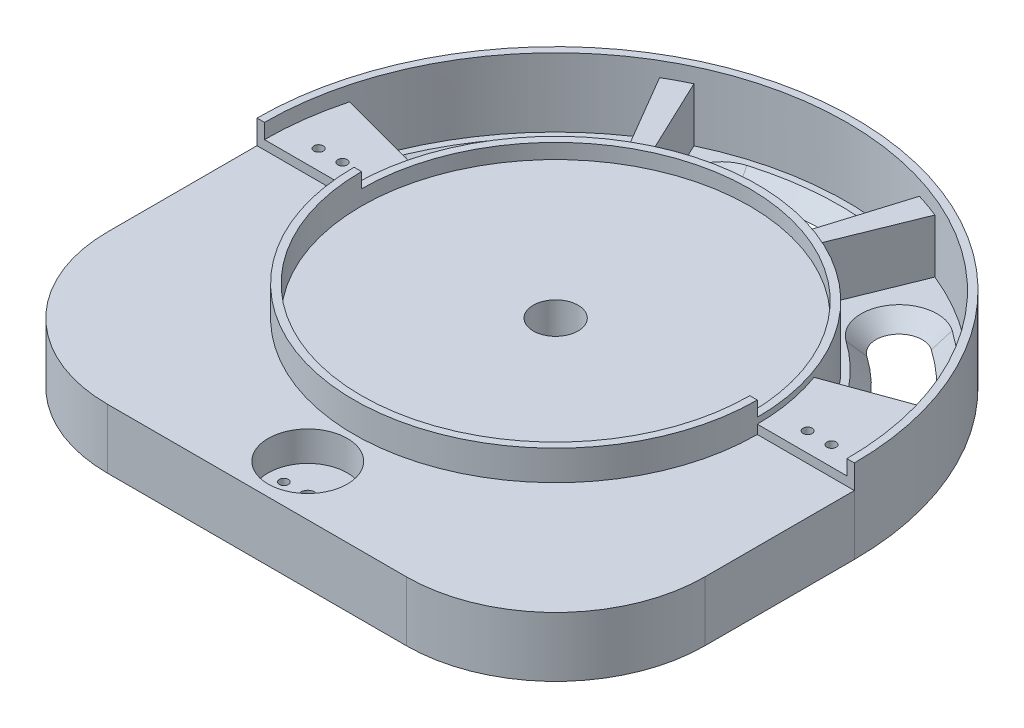
from build123d import *

# Parameters (mm, degrees)
BOSS_EXTRUDE1_DEPTH        = 33
CUT_EXTRUDE1_DEPTH         = 40
CUT_EXTRUDE2_DEPTH         = 40
CUT_EXTRUDE3_DEPTH         = 40
BOSS_EXTRUDE3_START        = 30
BOSS_EXTRUDE3_DEPTH        = 30
SKETCH26_W                 = 200
SKETCH26_H                 = 30
BOSS_EXTRUDE6_DEPTH        = 120
SKETCH28_R                 = 156.204993518
CUT_EXTRUDE4_DEPTH         = 40
CUT_EXTRUDE5_START         = -25
SKETCH29_R                 = 100
CUT_EXTRUDE5_DEPTH         = 25
CUT_EXTRUDE8_DEPTH         = 20
SKETCH31_R                 = 156.204993518
SKETCH31_R_2               = 100
CUT_EXTRUDE9_DEPTH         = 20
CUT_EXTRUDE10_DEPTH        = 20
BOSS_EXTRUDE8_START        = -10
SKETCH33_R                 = 65
BOSS_EXTRUDE8_DEPTH        = 10
CUT_EXTRUDE11_DEPTH        = 15
CHAMFER2_SIZE              = 7
SKETCH35_R                 = 7.5
CUT_EXTRUDE12_DEPTH        = 143.828568571
SKETCH36_R                 = 12.5
SKETCH36_R_2               = 7.5
BOSS_EXTRUDE9_DEPTH        = 5
SKETCH37_W                 = 200
SKETCH37_H                 = 100
BOSS_EXTRUDE10_DEPTH       = 20
SKETCH38_R                 = 7.5
CUT_EXTRUDE13_DEPTH        = 15
FILLET1_R                  = 50
SKETCH40_R                 = 97.5
CUT_EXTRUDE14_DEPTH        = 5
BOSS_EXTRUDE11_OUTLINE_R   = 67.5
BOSS_EXTRUDE11_OUTLINE_R_2 = 65
BOSS_EXTRUDE11_DEPTH       = 5
BOSS_EXTRUDE12_DEPTH       = 10
CUT_EXTRUDE15_DEPTH        = 143.828568571
CUT_EXTRUDE15_DEPTH_BACK   = 143.828568571
SKETCH48_R                 = 1.55
SKETCH50_R                 = 13.25
CUT_EXTRUDE16_DEPTH        = 10
CUT_EXTRUDE17_DEPTH        = 143.828568571
CUT_EXTRUDE17_DEPTH_BACK   = 143.828568571
SKETCH51_R                 = 2.25
SKETCH51_R_2               = 1.5
SKETCH52_R                 = 12.8
CUT_EXTRUDE18_DEPTH        = 5
CUT_EXTRUDE19_DEPTH        = 5
CUT_EXTRUDE20_DEPTH        = 5


# Read off the part's stored shape, not the designer's step: Boss-Extrude11
with BuildPart() as part:
    # Sketch1 → Boss-Extrude1 (new body)
    with BuildSketch(Plane(origin=(0, 0, 0), x_dir=(1, 0, 0), z_dir=(0, 1, 0))):
        with BuildLine():
            ThreePointArc((100, 0), (0, 100), (-100, 0))
            Line((-100, 0), (-65, 0))
            ThreePointArc((-65, 0), (0, 65), (65, 0))
            Line((65, 0), (100, 0))
        make_face()
    extrude(amount=BOSS_EXTRUDE1_DEPTH)

    # Sketch3 → Cut-Extrude1 (cut)
    with BuildSketch(Plane(origin=(0, 33, 0), x_dir=(1, 0, 0), z_dir=(0, 1, 0))):
        with BuildLine():
            ThreePointArc((91.620030527, 33.346963974), (70.158955681, 67.705028895), (36.586411012, 90.3752429))
            Line((36.586411012, 90.3752429), (25.329053777, 62.567475854))
            ThreePointArc((25.329053777, 62.567475854), (48.571584702, 46.872712312), (63.429251903, 23.086359674))
            Line((63.429251903, 23.086359674), (91.620030527, 33.346963974))
        make_face()
    extrude(amount=-CUT_EXTRUDE1_DEPTH, mode=Mode.SUBTRACT)

    # Sketch4 → Cut-Extrude2 (cut)
    with BuildSketch(Plane(origin=(0, 33, 0), x_dir=(1, 0, 0), z_dir=(0, 1, 0))):
        with BuildLine():
            Line((-41.791558708, 88.089248043), (-28.932617567, 60.98486403))
            ThreePointArc((-28.932617567, 60.98486403), (-4.909072096, 67.321252299), (19.779554251, 64.536960214))
            Line((19.779554251, 64.536960214), (28.570467251, 93.220053642))
            ThreePointArc((28.570467251, 93.220053642), (-7.090881917, 97.241808877), (-41.791558708, 88.089248043))
        make_face()
    extrude(amount=-CUT_EXTRUDE2_DEPTH, mode=Mode.SUBTRACT)

    # Sketch5 → Cut-Extrude3 (cut)
    with BuildSketch(Plane(origin=(0, 33, 0), x_dir=(1, 0, 0), z_dir=(0, 1, 0))):
        with BuildLine():
            ThreePointArc((-65.199993275, 17.470285544), (-53.687582374, 40.913243562), (-34.137701343, 58.231154436))
            Line((-34.137701343, 58.231154436), (-49.310013051, 84.111667519))
            ThreePointArc((-49.310013051, 84.111667519), (-77.548730096, 59.096907368), (-94.177768063, 25.234856897))
            Line((-94.177768063, 25.234856897), (-65.199993275, 17.470285544))
        make_face()
    extrude(amount=-CUT_EXTRUDE3_DEPTH, mode=Mode.SUBTRACT)

    # Sketch8 → Boss-Extrude3 (add)
    with BuildSketch(Plane.XZ.offset(BOSS_EXTRUDE3_START)):
        with BuildLine():
            Line((-65, 0), (-100, 0))
            ThreePointArc((-100, 0), (0, -100), (100, 0))
            Line((100, 0), (65, 0))
            ThreePointArc((65, 0), (0, -65), (-65, 0))
        make_face()
    extrude(amount=-BOSS_EXTRUDE3_DEPTH)

    # Sketch26 → Boss-Extrude6 (add)
    with BuildSketch(Plane.XY):
        with Locations((0, -15)):
            Rectangle(SKETCH26_W, SKETCH26_H)
    extrude(amount=BOSS_EXTRUDE6_DEPTH)

    # Sketch28 → Cut-Extrude4 (cut)
    with BuildSketch(Plane.XZ.offset(60)):
        Circle(SKETCH28_R)
    extrude(amount=-CUT_EXTRUDE4_DEPTH, mode=Mode.SUBTRACT)

    # Sketch29 → Cut-Extrude5 (cut)
    with BuildSketch(Plane(origin=(0, 33, 0), x_dir=(1, 0, 0), z_dir=(0, 1, 0)).offset(CUT_EXTRUDE5_START)):
        Circle(SKETCH29_R)
    extrude(amount=CUT_EXTRUDE5_DEPTH, mode=Mode.SUBTRACT)

    # Sketch30 → Cut-Extrude8 (cut)
    with BuildSketch(Plane.XZ.offset(20)):
        with BuildLine():
            ThreePointArc((-99.143723606, 13.058409912), (6.543227008, 99.785701282), (100, 0))
            Line((100, 0), (100, 120))
            Line((100, 120), (-100, 120))
            Line((-100, 120), (-99.143723606, 13.058409912))
        make_face()
    extrude(amount=-CUT_EXTRUDE8_DEPTH, mode=Mode.SUBTRACT)

    # Sketch31 → Cut-Extrude9 (cut)
    with BuildSketch(Plane(origin=(0, -20, 0), x_dir=(-1, 0, 0), z_dir=(0, -1, 0))):
        Circle(SKETCH31_R)
        with Locations(Location((0, 0, 0), (0, 0, 90))):
            Circle(SKETCH31_R_2, mode=Mode.SUBTRACT)
    extrude(amount=-CUT_EXTRUDE9_DEPTH, mode=Mode.SUBTRACT)

    # Sketch32 → Cut-Extrude10 (cut)
    with BuildSketch(Plane(origin=(0, 0, 0), x_dir=(1, 0, 0), z_dir=(0, 1, 0))):
        with BuildLine():
            ThreePointArc((66.28370188, 38.682846188), (74.154069941, 36.613340263), (76.223575866, 44.483708324))
            ThreePointArc((76.223575866, 44.483708324), (65.061093766, 59.631266145), (50.941192214, 72.068222955))
            ThreePointArc((50.941192214, 72.068222955), (42.920720385, 70.690696246), (44.298247095, 62.670224417))
            ThreePointArc((44.298247095, 62.670224417), (56.576854263, 51.855098937), (66.28370188, 38.682846188))
        make_face()
        with BuildLine():
            ThreePointArc((10.489916637, 76.025346912), (16.976811553, 80.939178669), (12.062979796, 87.426073585))
            ThreePointArc((12.062979796, 87.426073585), (-6.744582107, 87.996275127), (-25.24556204, 84.566514776))
            ThreePointArc((-25.24556204, 84.566514776), (-29.113412559, 77.406537084), (-21.953434866, 73.538686565))
            ThreePointArc((-21.953434866, 73.538686565), (-5.865060312, 76.521191781), (10.489916637, 76.025346912))
        make_face()
        with BuildLine():
            ThreePointArc((-51.296662451, 57.083659181), (-50.862754743, 65.209991213), (-58.989086775, 65.643898921))
            ThreePointArc((-58.989086775, 65.643898921), (-71.788973817, 51.333975711), (-81.19140666, 34.594642774))
            ThreePointArc((-81.19140666, 34.594642774), (-78.153199938, 27.045149539), (-70.603706703, 30.083356261))
            ThreePointArc((-70.603706703, 30.083356261), (-62.427390538, 44.639809976), (-51.296662451, 57.083659181))
        make_face()
    extrude(amount=-CUT_EXTRUDE10_DEPTH, mode=Mode.SUBTRACT)

    # Sketch33 → Boss-Extrude8 (add)
    with BuildSketch(Plane(origin=(0, 0, 0), x_dir=(1, 0, 0), z_dir=(0, 1, 0)).offset(BOSS_EXTRUDE8_START)):
        Circle(SKETCH33_R)
    extrude(amount=BOSS_EXTRUDE8_DEPTH)

    # Sketch34 → Cut-Extrude11 (cut)
    with BuildSketch(Plane(origin=(0, 0, 0), x_dir=(1, 0, 0), z_dir=(0, 1, 0))):
        with BuildLine():
            Line((63.429251903, 23.086359674), (91.620030527, 33.346963974))
            ThreePointArc((91.620030527, 33.346963974), (70.158955681, 67.705028895), (36.586411012, 90.3752429))
            Line((36.586411012, 90.3752429), (25.329053777, 62.567475854))
            ThreePointArc((25.329053777, 62.567475854), (48.571584702, 46.872712312), (63.429251903, 23.086359674))
        make_face()
        with BuildLine():
            Line((19.779554251, 64.536960214), (28.570467251, 93.220053642))
            ThreePointArc((28.570467251, 93.220053642), (-7.090881917, 97.241808877), (-41.791558708, 88.089248043))
            Line((-41.791558708, 88.089248043), (-28.932617567, 60.98486403))
            ThreePointArc((-28.932617567, 60.98486403), (-4.909072096, 67.321252299), (19.779554251, 64.536960214))
        make_face()
        with BuildLine():
            Line((-34.137701343, 58.231154436), (-49.310013051, 84.111667519))
            ThreePointArc((-49.310013051, 84.111667519), (-77.548730096, 59.096907368), (-94.177768063, 25.234856897))
            Line((-94.177768063, 25.234856897), (-65.199993275, 17.470285544))
            ThreePointArc((-65.199993275, 17.470285544), (-53.687582374, 40.913243562), (-34.137701343, 58.231154436))
        make_face()
    extrude(amount=-CUT_EXTRUDE11_DEPTH, mode=Mode.SUBTRACT)

    # Chamfer2
    # the kernel refuses this chamfer: 7 mm, written as the material it takes off along each edge
    with BuildSketch(Plane(origin=(0, -15, 0), x_dir=(-0.6683984801552533, 0, -0.7438033824379582), z_dir=(0.7438033824379582, 0, -0.6683984801552533))) as chamfer2_piece_1:
        Polygon((88.25437, -CHAMFER2_SIZE), (88.25437 + CHAMFER2_SIZE, 0), (88.25437, 0), align=None)
    revolve(axis=Axis((0, -15, 0), (0, 1, 0)), revolution_arc=24.978173914, mode=Mode.SUBTRACT)
    with BuildSketch(Plane(origin=(-55.142874613, -15, -61.363779051), x_dir=(0.668398480155252, 0, 0.7438033824379592), z_dir=(-0.7438033824379592, 0, 0.668398480155252))) as chamfer2_piece_2:
        Polygon((5.75437, -CHAMFER2_SIZE), (5.75437 + CHAMFER2_SIZE, 0), (5.75437, 0), align=None)
    revolve(axis=Axis((-55.142874613, -15, -61.363779051), (0, 1, 0)), revolution_arc=180, mode=Mode.SUBTRACT)
    with BuildSketch(Plane(origin=(-75.897556681, -15, -32.338999517), x_dir=(-0.919970384017718, 0, -0.3919878729377892), z_dir=(0.3919878729377892, 0, -0.919970384017718))) as chamfer2_piece_3_section:
        Polygon((5.75437, -CHAMFER2_SIZE), (5.75437 + CHAMFER2_SIZE, 0), (5.75437, 0), align=None)
    chamfer2_piece_3 = revolve(axis=Axis((-75.897556681, -15, -32.338999517), (0, 1, 0)), revolution_arc=180, mode=Mode.PRIVATE)
    chamfer2_piece_3 = split(chamfer2_piece_3, bisect_by=Plane(origin=(-80.145870911, -18.437935535, -21.475021387), z_dir=(0.2588190451025148, 0, -0.9659258262890699)), keep=Keep.TOP, mode=Mode.PRIVATE)
    add(chamfer2_piece_3, mode=Mode.SUBTRACT)
    with BuildSketch(Plane(origin=(0, -15, 0), x_dir=(-0.6683984801552512, 0, -0.7438033824379602), z_dir=(0.7438033824379602, 0, -0.6683984801552512))) as chamfer2_piece_4:
        Polygon((76.74563, -CHAMFER2_SIZE), (76.74563 - CHAMFER2_SIZE, 0), (76.74563, 0), align=None)
    revolve(axis=Axis((0, -15, 0), (0, 1, 0)), revolution_arc=24.978173914, mode=Mode.SUBTRACT)
    with BuildSketch(Plane(origin=(0, -15, 0), x_dir=(0.1366842208067535, 0, -0.9906146696786046), z_dir=(0.9906146696786046, 0, 0.1366842208067535))) as chamfer2_piece_5:
        Polygon((88.25437, -CHAMFER2_SIZE), (88.25437 + CHAMFER2_SIZE, 0), (88.25437, 0), align=None)
    revolve(axis=Axis((0, -15, 0), (0, 1, 0)), revolution_arc=24.477914532, mode=Mode.SUBTRACT)
    with BuildSketch(Plane(origin=(11.276448217, -15, -81.725710248), x_dir=(-0.13668422080675505, 0, 0.9906146696786042), z_dir=(-0.9906146696786042, 0, -0.13668422080675505))) as chamfer2_piece_6:
        Polygon((5.75437, -CHAMFER2_SIZE), (5.75437 + CHAMFER2_SIZE, 0), (5.75437, 0), align=None)
    revolve(axis=Axis((11.276448217, -15, -81.725710248), (0, 1, 0)), revolution_arc=180, mode=Mode.SUBTRACT)
    with BuildSketch(Plane(origin=(-23.599498453, -15, -79.052600671), x_dir=(-0.2860545267014413, 0, -0.9582133414608746), z_dir=(0.9582133414608746, 0, -0.2860545267014413))) as chamfer2_piece_7_section:
        Polygon((5.75437, -CHAMFER2_SIZE), (5.75437 + CHAMFER2_SIZE, 0), (5.75437, 0), align=None)
    chamfer2_piece_7 = revolve(axis=Axis((-23.599498453, -15, -79.052600671), (0, 1, 0)), revolution_arc=180, mode=Mode.PRIVATE)
    chamfer2_piece_7 = split(chamfer2_piece_7, bisect_by=Plane(origin=(-35.54966771, -18.437744319, -74.93244075), z_dir=(0.9034794671049792, 0, -0.428631371366706)), keep=Keep.TOP, mode=Mode.PRIVATE)
    add(chamfer2_piece_7, mode=Mode.SUBTRACT)
    with BuildSketch(Plane(origin=(0, -15, 0), x_dir=(0.13668422080675355, 0, -0.9906146696786046), z_dir=(0.9906146696786046, 0, 0.13668422080675355))) as chamfer2_piece_8:
        Polygon((76.74563, -CHAMFER2_SIZE), (76.74563 - CHAMFER2_SIZE, 0), (76.74563, 0), align=None)
    revolve(axis=Axis((0, -15, 0), (0, 1, 0)), revolution_arc=24.477914532, mode=Mode.SUBTRACT)
    with BuildSketch(Plane(origin=(0, -15, 0), x_dir=(0.8636804711885281, 0, -0.5040397243150209), z_dir=(0.5040397243150209, 0, 0.8636804711885281))) as chamfer2_piece_9:
        Polygon((88.25437, -CHAMFER2_SIZE), (88.25437 + CHAMFER2_SIZE, 0), (88.25437, 0), align=None)
    revolve(axis=Axis((0, -15, 0), (0, 1, 0)), revolution_arc=24.477914532, mode=Mode.SUBTRACT)
    with BuildSketch(Plane(origin=(71.253638873, -15, -41.583277256), x_dir=(-0.8636804711885285, 0, 0.5040397243150201), z_dir=(-0.5040397243150201, 0, -0.8636804711885285))) as chamfer2_piece_10:
        Polygon((5.75437, -CHAMFER2_SIZE), (5.75437 + CHAMFER2_SIZE, 0), (5.75437, 0), align=None)
    revolve(axis=Axis((71.253638873, -15, -41.583277256), (0, 1, 0)), revolution_arc=180, mode=Mode.SUBTRACT)
    with BuildSketch(Plane(origin=(47.619719655, -15, -67.369223686), x_dir=(0.577208723085647, 0, -0.8165966507363577), z_dir=(0.8165966507363577, 0, 0.577208723085647))) as chamfer2_piece_11:
        Polygon((5.75437, -CHAMFER2_SIZE), (5.75437 + CHAMFER2_SIZE, 0), (5.75437, 0), align=None)
    revolve(axis=Axis((47.619719655, -15, -67.369223686), (0, 1, 0)), revolution_arc=180, mode=Mode.SUBTRACT)
    with BuildSketch(Plane(origin=(0, -15, 0), x_dir=(0.8636804711885259, 0, -0.5040397243150245), z_dir=(0.5040397243150245, 0, 0.8636804711885259))) as chamfer2_piece_12:
        Polygon((76.74563, -CHAMFER2_SIZE), (76.74563 - CHAMFER2_SIZE, 0), (76.74563, 0), align=None)
    revolve(axis=Axis((0, -15, 0), (0, 1, 0)), revolution_arc=24.477914532, mode=Mode.SUBTRACT)

    # Sketch35 → Cut-Extrude12 (cut, through all)
    with BuildSketch(Plane(origin=(0, 0, 0), x_dir=(1, 0, 0), z_dir=(0, 1, 0))):
        with Locations(Location((0, 0, 0), (0, 0, 270))):
            Circle(SKETCH35_R)
    extrude(amount=-CUT_EXTRUDE12_DEPTH, mode=Mode.SUBTRACT)

    # Sketch36 → Boss-Extrude9 (add)
    with BuildSketch(Plane(origin=(0, -10, 0), x_dir=(-1, 0, 0), z_dir=(0, -1, 0))):
        Circle(SKETCH36_R)
        with Locations(Location((0, 0, 0), (0, 0, 270))):
            Circle(SKETCH36_R_2, mode=Mode.SUBTRACT)
    extrude(amount=BOSS_EXTRUDE9_DEPTH)

    # Sketch37 → Boss-Extrude10 (add)
    with BuildSketch(Plane(origin=(0, 0, 0), x_dir=(1, 0, 0), z_dir=(0, 1, 0))):
        with Locations((0, -50)):
            Rectangle(SKETCH37_W, SKETCH37_H)
    extrude(amount=-BOSS_EXTRUDE10_DEPTH)

    # Sketch38 → Cut-Extrude13 (cut)
    with BuildSketch(Plane(origin=(0, 0, 0), x_dir=(1, 0, 0), z_dir=(0, 1, 0))):
        with Locations(Location((0, 0, 0), (0, 0, 270))):
            Circle(SKETCH38_R)
    extrude(amount=-CUT_EXTRUDE13_DEPTH, mode=Mode.SUBTRACT)

    # Fillet1
    fillet1_edges = [part.edges().sort_by_distance(p)[0] for p in [
        (-100, -10, 100),
        (100, -10, 100),
    ]]
    fillet(fillet1_edges, radius=FILLET1_R)

    # Sketch40 → Cut-Extrude14 (cut)
    with BuildSketch(Plane(origin=(0, 8, 0), x_dir=(1, 0, 0), z_dir=(0, 1, 0))):
        Circle(SKETCH40_R)
    extrude(amount=-CUT_EXTRUDE14_DEPTH, mode=Mode.SUBTRACT)

    # Boss-Extrude11 outline → Boss-Extrude11 (add)
    with BuildSketch(Plane(origin=(0, 0, 0), x_dir=(1, 0, 0), z_dir=(0, 1, 0))):
        Circle(BOSS_EXTRUDE11_OUTLINE_R)
        Circle(BOSS_EXTRUDE11_OUTLINE_R_2, mode=Mode.SUBTRACT)
    extrude(amount=BOSS_EXTRUDE11_DEPTH)

    # Sketch44 → Boss-Extrude12 (add)
    with BuildSketch(Plane(origin=(0, 0, 0), x_dir=(1, 0, 0), z_dir=(0, 1, 0))):
        with BuildLine():
            Line((-67.5, 0), (-65, 0))
            ThreePointArc((-65, 0), (0, -65), (65, 0))
            Line((65, 0), (67.5, 0))
            ThreePointArc((67.5, 0), (0, -67.5), (-67.5, 0))
        make_face()
    extrude(amount=BOSS_EXTRUDE12_DEPTH)

    # Sketch48 → Cut-Extrude15 (cut, two sides: drawn at the far end of the back side and taken through both)
    with BuildSketch(Plane(origin=(0, 0, 0), x_dir=(1, 0, 0), z_dir=(0, 1, 0)).offset(-CUT_EXTRUDE15_DEPTH_BACK)):
        with Locations(Location((-85.865, 6.5, 0), (0, 0, 270))):
            Circle(SKETCH48_R)
        with Locations(Location((-77.865, 6.5, 0), (0, 0, 270))):
            Circle(SKETCH48_R)
        with Locations(Location((77.865, 6.5, 0), (0, 0, 270))):
            Circle(SKETCH48_R)
        with Locations(Location((85.865, 6.5, 0), (0, 0, 270))):
            Circle(SKETCH48_R)
    extrude(amount=CUT_EXTRUDE15_DEPTH + CUT_EXTRUDE15_DEPTH_BACK, mode=Mode.SUBTRACT)

    # Sketch50 → Cut-Extrude16 (cut)
    with BuildSketch(Plane(origin=(0, 0, 0), x_dir=(1, 0, 0), z_dir=(0, 1, 0))):
        with Locations(Location((0, -83, 0), (0, 0, 270))):
            Circle(SKETCH50_R)
    extrude(amount=-CUT_EXTRUDE16_DEPTH, mode=Mode.SUBTRACT)

    # Sketch51 → Cut-Extrude17 (cut, two sides: drawn at the far end of the back side and taken through both)
    with BuildSketch(Plane(origin=(0, -10, 0), x_dir=(1, 0, 0), z_dir=(0, 1, 0)).offset(-CUT_EXTRUDE17_DEPTH_BACK)):
        with Locations(Location((0, -83, 0), (0, 0, 270))):
            Circle(SKETCH51_R)
        with Locations(Location((-8, -83, 0), (0, 0, 270))):
            Circle(SKETCH51_R_2)
        with Locations(Location((8, -83, 0), (0, 0, 270))):
            Circle(SKETCH51_R_2)
    extrude(amount=CUT_EXTRUDE17_DEPTH + CUT_EXTRUDE17_DEPTH_BACK, mode=Mode.SUBTRACT)

    # Sketch52 → Cut-Extrude18 (cut)
    with BuildSketch(Plane.XZ.offset(20)):
        with Locations(Location((0, 83, 0), (0, 0, 270))):
            Circle(SKETCH52_R)
    extrude(amount=-CUT_EXTRUDE18_DEPTH, mode=Mode.SUBTRACT)

    # Sketch53 → Cut-Extrude19 (cut)
    with BuildSketch(Plane.XZ.offset(20)):
        with BuildLine():
            ThreePointArc((12.8, 83), (0, 70.2), (-12.8, 83))
            Line((-12.8, 83), (-36.25, 0))
            Line((-36.25, 0), (0, 0))
            Line((0, 0), (36.25, 0))
            Line((36.25, 0), (12.8, 83))
        make_face()
    extrude(amount=-CUT_EXTRUDE19_DEPTH, mode=Mode.SUBTRACT)

    # Sketch54 → Cut-Extrude20 (cut)
    with BuildSketch(Plane.XZ.offset(20)):
        Polygon((-85.865, -9.964101615), (-82.865, -8.232050808), (-82.865, -4.767949192), (-85.865, -3.035898385), (-88.865, -4.767949192), (-88.865, -8.232050808), align=None)
        Polygon((-77.865, -9.964101615), (-74.865, -8.232050808), (-74.865, -4.767949192), (-77.865, -3.035898385), (-80.865, -4.767949192), (-80.865, -8.232050808), align=None)
        Polygon((77.865, -9.964101615), (80.865, -8.232050808), (80.865, -4.767949192), (77.865, -3.035898385), (74.865, -4.767949192), (74.865, -8.232050808), align=None)
        Polygon((85.865, -9.964101615), (88.865, -8.232050808), (88.865, -4.767949192), (85.865, -3.035898385), (82.865, -4.767949192), (82.865, -8.232050808), align=None)
    extrude(amount=-CUT_EXTRUDE20_DEPTH, mode=Mode.SUBTRACT)


solid = part.part
